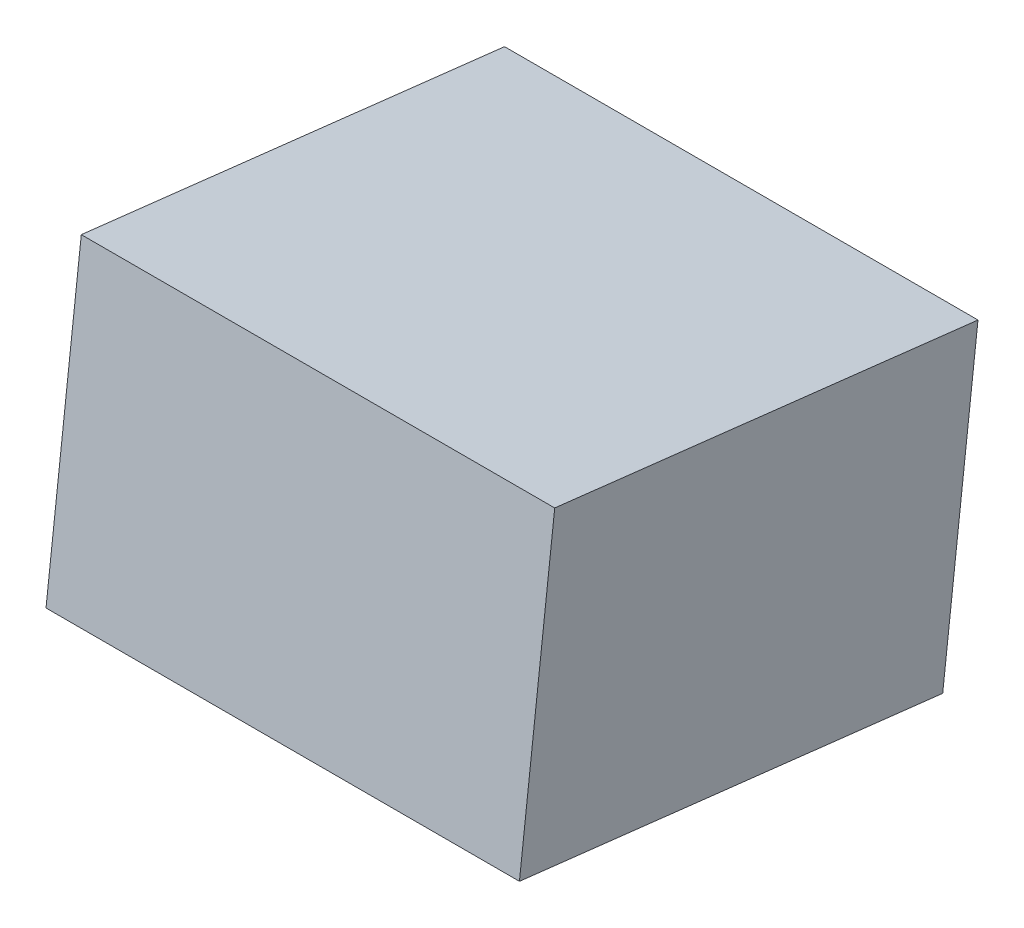
from build123d import *

# Parameters (mm, degrees)
SKETCH1_W           = 200
SKETCH1_H           = 180
BOSS_EXTRUDE1_DEPTH = 130


with BuildPart() as part:
    # Sketch1 → Boss-Extrude1 (new body)
    with BuildSketch(Plane(origin=(0, 358.879876801, -41.422455829), x_dir=(1, 0, 0), z_dir=(-6.837425950214788e-15, 0.9934047622419533, -0.1146602736566085))):
        with Locations((-135, 165.244347434)):
            Rectangle(SKETCH1_W, SKETCH1_H)
    extrude(amount=BOSS_EXTRUDE1_DEPTH)


solid = part.part
